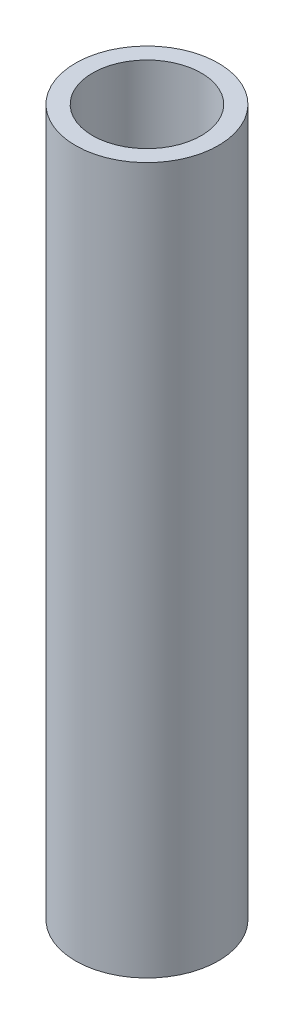
from build123d import *

# Parameters (mm, degrees)
SKETCH1_R           = 16.7005
SKETCH1_R_2         = 12.7
BOSS_EXTRUDE1_DEPTH = 165.1


with BuildPart() as part:
    # Sketch1 → Boss-Extrude1 (new body)
    with BuildSketch(Plane(origin=(0, 0, 0), x_dir=(1, 0, 0), z_dir=(0, 1, 0))):
        Circle(SKETCH1_R)
        Circle(SKETCH1_R_2, mode=Mode.SUBTRACT)
    extrude(amount=BOSS_EXTRUDE1_DEPTH)


solid = part.part
